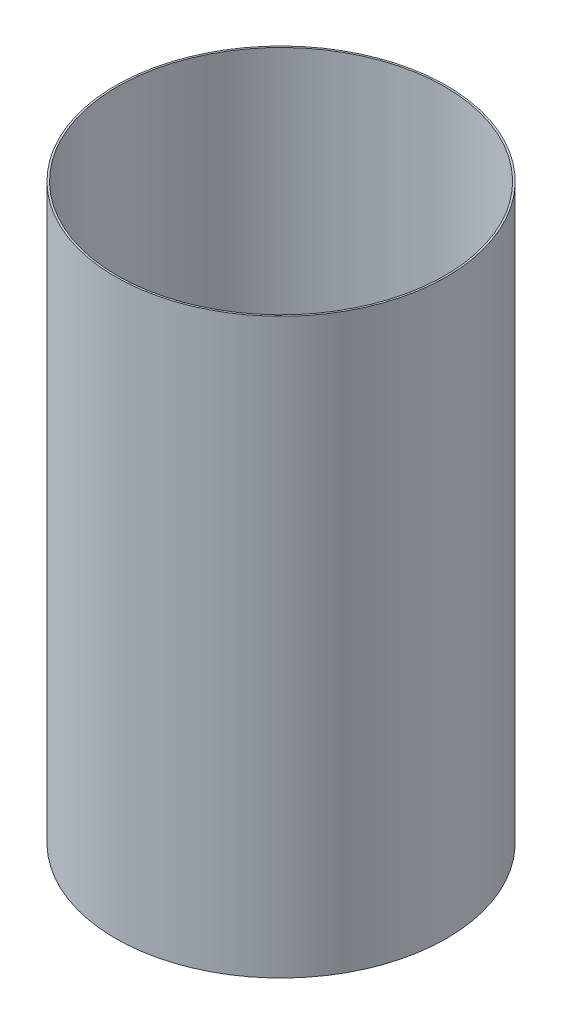
from build123d import *

# Parameters (mm, degrees)
SKETCH1_R           = 51.3588
SKETCH1_R_2         = 50.8
EXTRUDE_THIN1_DEPTH = 177.8


with BuildPart() as part:
    # Sketch1 → Extrude-Thin1 (new body)
    with BuildSketch(Plane(origin=(0, 0, 0), x_dir=(1, 0, 0), z_dir=(0, 1, 0))):
        Circle(SKETCH1_R)
        Circle(SKETCH1_R_2, mode=Mode.SUBTRACT)
    extrude(amount=EXTRUDE_THIN1_DEPTH)


solid = part.part
